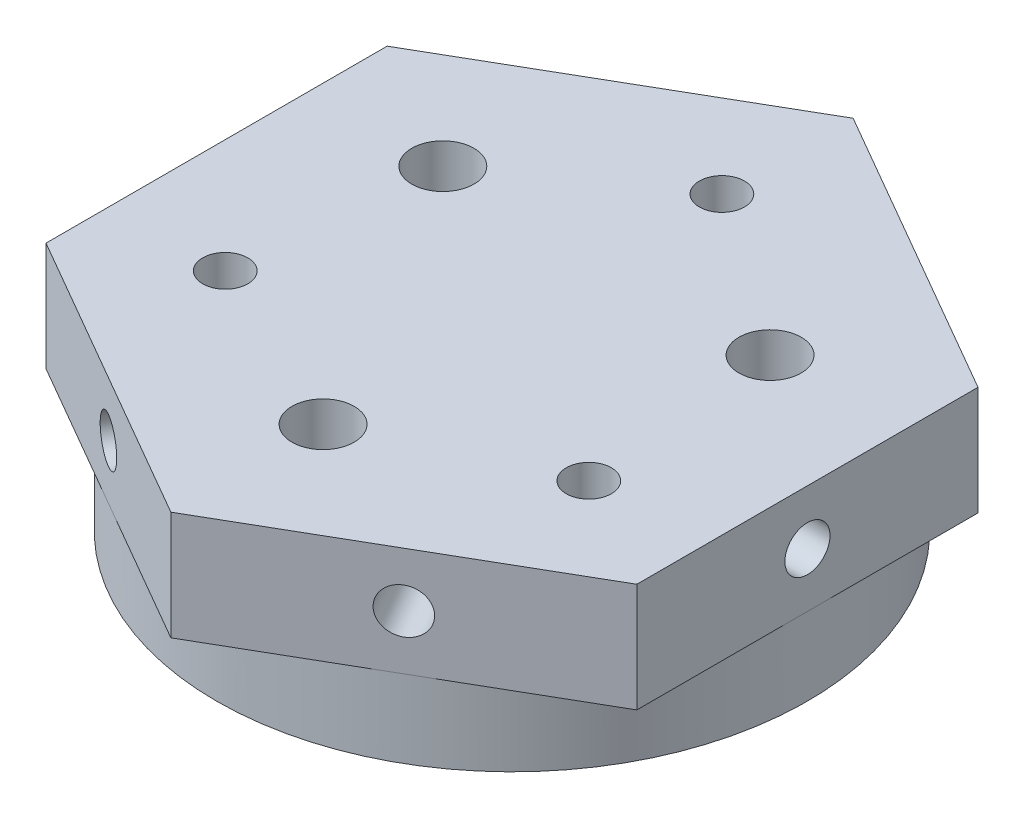
from build123d import *

# Parameters (mm, degrees)
SKETCH_1_R          = 19
SKETCH_1_R_2        = 1.45
SKETCH_1_R_3        = 2
EXTRUDE_1_DEPTH     = 12
EXTRUDE_START       = -7
SKETCH_2_R          = 1.45
SKETCH_2_R_2        = 2
EXTRUDE_2_DEPTH     = 7
SKETCH_3_R          = 1.45
CUT_EXTRUDE_1_DEPTH = 8
SKETCH_4_R          = 1.45
CUT_EXTRUDE_2_DEPTH = 8
SKETCH_5_R          = 1.45
CUT_EXTRUDE_3_DEPTH = 8
CUT_EXTRUDE_START   = -8
SKETCH_6_R          = 1.45
CUT_EXTRUDE_4_DEPTH = 8
SKETCH_7_R          = 1.45
CUT_EXTRUDE_5_DEPTH = 8


with BuildPart() as part:
    # 草图1 → 凸台-拉伸1 (new body)
    with BuildSketch(Plane(origin=(0, 0, 0), x_dir=(1, 0, 0), z_dir=(0, 1, 0))):
        Circle(SKETCH_1_R)
        with Locations((0, 13.5)):
            Circle(SKETCH_1_R_2, mode=Mode.SUBTRACT)
        with Locations((-11.691342951, -6.75)):
            Circle(SKETCH_1_R_2, mode=Mode.SUBTRACT)
        with Locations((11.691342951, -6.75)):
            Circle(SKETCH_1_R_2, mode=Mode.SUBTRACT)
        with Locations((-10.522208656, 6.075)):
            Circle(SKETCH_1_R_3, mode=Mode.SUBTRACT)
        with Locations((0, -12.15)):
            Circle(SKETCH_1_R_3, mode=Mode.SUBTRACT)
        with Locations((10.522208656, 6.075)):
            Circle(SKETCH_1_R_3, mode=Mode.SUBTRACT)
    extrude(amount=EXTRUDE_1_DEPTH)

    # 草图2 → 凸台-拉伸2 (add)
    with BuildSketch(Plane(origin=(0, 12, 0), x_dir=(1, 0, 0), z_dir=(0, 1, 0)).offset(EXTRUDE_START)):
        Polygon((0, 21.939310229), (-19, 10.969655115), (-19, -10.969655115), (0, -21.939310229), (19, -10.969655115), (19, 10.969655115), align=None)
        with Locations((0, 13.5)):
            Circle(SKETCH_2_R, mode=Mode.SUBTRACT)
        with Locations((-10.522208656, 6.075)):
            Circle(SKETCH_2_R_2, mode=Mode.SUBTRACT)
        with Locations((10.522208656, 6.075)):
            Circle(SKETCH_2_R_2, mode=Mode.SUBTRACT)
        with Locations((-11.691342951, -6.75)):
            Circle(SKETCH_2_R, mode=Mode.SUBTRACT)
        with Locations((0, -12.15)):
            Circle(SKETCH_2_R_2, mode=Mode.SUBTRACT)
        with Locations((11.691342951, -6.75)):
            Circle(SKETCH_2_R, mode=Mode.SUBTRACT)
    extrude(amount=EXTRUDE_2_DEPTH)

    # 草图3 → 切除-拉伸1 (cut)
    with BuildSketch(Plane(origin=(9.5, 0, 16.454482672), x_dir=(0.8660254037844384, 0, -0.5000000000000004), z_dir=(0.5000000000000004, 0, 0.8660254037844384))):
        with Locations((0, 8.5)):
            Circle(SKETCH_3_R)
    extrude(amount=-CUT_EXTRUDE_1_DEPTH, mode=Mode.SUBTRACT)

    # 草图4 → 切除-拉伸2 (cut)
    with BuildSketch(Plane(origin=(-9.5, 0, 16.454482672), x_dir=(0.8660254037844385, 0, 0.5000000000000004), z_dir=(-0.5000000000000003, 0, 0.8660254037844384))):
        with Locations((0, 8.5)):
            Circle(SKETCH_4_R)
    extrude(amount=-CUT_EXTRUDE_2_DEPTH, mode=Mode.SUBTRACT)

    # 草图5 → 切除-拉伸3 (cut)
    with BuildSketch(Plane.ZY.offset(19)):
        with Locations((0, 8.5)):
            Circle(SKETCH_5_R)
    extrude(amount=-CUT_EXTRUDE_3_DEPTH, mode=Mode.SUBTRACT)

    # 草图6 → 切除-拉伸4 (cut)
    with BuildSketch(Plane(origin=(19, 0, 0), x_dir=(0, 0, -1), z_dir=(1, 0, 0)).offset(CUT_EXTRUDE_START)):
        with Locations((0, 8.5)):
            Circle(SKETCH_6_R)
    extrude(amount=CUT_EXTRUDE_4_DEPTH, mode=Mode.SUBTRACT)

    # 草图7 → 切除-拉伸5 (cut)
    with BuildSketch(Plane(origin=(9.5, 0, -16.454482672), x_dir=(-0.8660254037844387, 0, -0.49999999999999994), z_dir=(0.4999999999999999, 0, -0.8660254037844386)).offset(CUT_EXTRUDE_START)):
        with Locations((0, 8.5)):
            Circle(SKETCH_7_R)
    extrude(amount=CUT_EXTRUDE_5_DEPTH, mode=Mode.SUBTRACT)


solid = part.part
